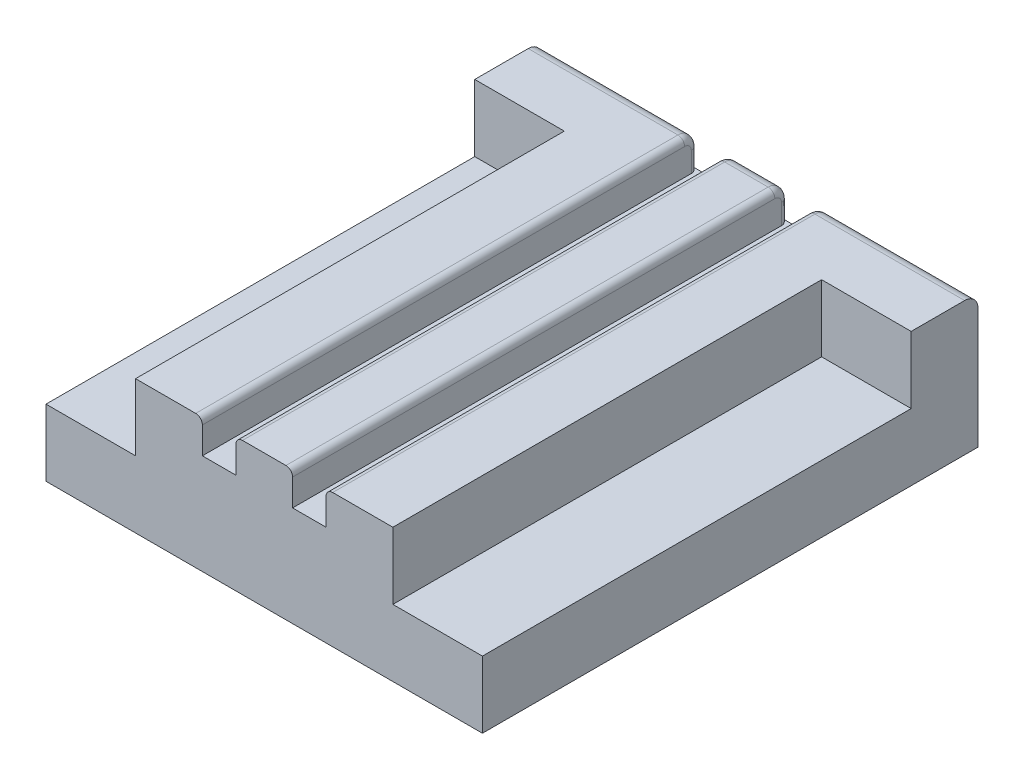
from build123d import *

# Parameters (mm, degrees)
SKETCH1_W                                  = 240
SKETCH1_H                                  = 200
BOSS_EXTRUDE1_DEPTH                        = 20
SKETCH7_W                                  = 120
SKETCH7_H                                  = 50
BOSS_EXTRUDE6_DEPTH                        = 20
FILLET1_R                                  = 2
SKETCH2_W                                  = 39.3
SKETCH2_H                                  = 125.7
CUT_EXTRUDE1_DEPTH                         = 10
CUT_EXTRUDE3_DEPTH                         = 5
MIRROR4_AT_THE_SECOND_PLANE_COPY_1_DEPTH   = 5
SKETCH11_W                                 = 104.748042719
SKETCH11_H                                 = 5
CUT_EXTRUDE4_DEPTH                         = 5
MIRROR6_AT_THE_SECOND_PLANE_COPY_1_SKETC_W = 104.748042719
MIRROR6_AT_THE_SECOND_PLANE_COPY_1_SKETC_H = 5
MIRROR6_AT_THE_SECOND_PLANE_COPY_1_DEPTH   = 5
SHELL1_START                               = 10
SHELL1_OUTLINE_W                           = 80.35
SHELL1_OUTLINE_H                           = 28.5
SHELL1_DEPTH                               = 10
FILLET3_R                                  = 1
SKETCH13_W                                 = 7.252545243
SKETCH13_H                                 = 2.335565418
SKETCH13_W_2                               = 1.720942939
SKETCH13_H_2                               = 2.581414408
CUT_EXTRUDE5_DEPTH                         = 2
CUT_EXTRUDE6_DEPTH                         = 10
MIRROR7_AT_THE_SECOND_PLANE_COPY_1_DEPTH   = 10
SKETCH15_W                                 = 101.789001661
SKETCH15_H                                 = 87.14110882
CUT_EXTRUDE7_DEPTH                         = 194.132079158
SKETCH16_W                                 = 242.295320333
SKETCH16_H                                 = 232.707041296
CUT_EXTRUDE8_DEPTH                         = 194.132079158


# Read off the part's stored shape, not the designer's step: Shell1
with BuildPart() as part:
    # Sketch1 → Boss-Extrude1 (new body)
    with BuildSketch(Plane(origin=(0, 0, 0), x_dir=(1, 0, 0), z_dir=(0, 1, 0))):
        Rectangle(SKETCH1_W, SKETCH1_H)
    extrude(amount=BOSS_EXTRUDE1_DEPTH)

    # Sketch7 → Boss-Extrude6 (add)
    with BuildSketch(Plane(origin=(0, 0, 0), x_dir=(1, 0, 0), z_dir=(0, 1, 0))):
        with Locations((0, 125)):
            Rectangle(SKETCH7_W, SKETCH7_H)
        with Locations((0, -125)):
            Rectangle(SKETCH7_W, SKETCH7_H)
    extrude(amount=BOSS_EXTRUDE6_DEPTH)

    # Fillet1
    fillet1_edges = [part.edges().sort_by_distance(p)[0] for p in [
        (-120, 20, 0),
        (90, 20, 100),
        (-90, 20, 100),
        (-60, 10, 150),
        (60, 10, 150),
        (-60, 20, 125),
        (0, 20, 150),
        (60, 20, 125),
        (-90, 20, -100),
        (60, 20, -125),
        (0, 20, -150),
        (60, 10, -150),
        (-60, 10, -150),
        (-60, 20, -125),
        (120, 20, 0),
        (120, 10, 100),
        (-120, 10, 100),
        (-120, 10, -100),
        (120, 10, -100),
        (90, 20, -100),
    ]]
    fillet(fillet1_edges, radius=FILLET1_R)

    # Sketch2 → Cut-Extrude1 (cut)
    with BuildSketch(Plane(origin=(0, 20, 0), x_dir=(1, 0, 0), z_dir=(0, 1, 0))):
        Rectangle(SKETCH2_W, SKETCH2_H)
    extrude(amount=-CUT_EXTRUDE1_DEPTH, mode=Mode.SUBTRACT)

    # Sketch10 → Cut-Extrude3 (cut)
    with BuildSketch(Plane(origin=(0, 20, 0), x_dir=(1, 0, 0), z_dir=(0, 1, 0))):
        Polygon((-9.25, -40.5), (-9.25, -33.162899401), (-4.25, -33.162899401), (-4.25, -40.5), (-4.25, -156.832928994), (-9.25, -156.832928994), align=None)
    cut_extrude3 = extrude(amount=-CUT_EXTRUDE3_DEPTH, mode=Mode.SUBTRACT)

    # Mirror4: Cut-Extrude3 across plane
    add(cut_extrude3.mirror(Plane(origin=(0, 0, 0), x_dir=(0, 0, 1), z_dir=(1, 0, 0))), mode=Mode.SUBTRACT)

    # Mirror4 at the second plane: Cut-Extrude3 across plane
    add(cut_extrude3.mirror(Plane.XY), mode=Mode.SUBTRACT)

    # Mirror4 at the second plane copy 1 sketc → Mirror4 at the second plane copy 1 (cut)
    with BuildSketch(Plane(origin=(0, 20, 0), x_dir=(-1, 0, 0), z_dir=(0, 1, 0))):
        Polygon((-9.25, -40.5), (-9.25, -33.162899401), (-4.25, -33.162899401), (-4.25, -40.5), (-4.25, -156.832928994), (-9.25, -156.832928994), align=None)
    extrude(amount=-MIRROR4_AT_THE_SECOND_PLANE_COPY_1_DEPTH, mode=Mode.SUBTRACT)

    # Sketch11 → Cut-Extrude4 (cut)
    with BuildSketch(Plane(origin=(0, 20, 0), x_dir=(1, 0, 0), z_dir=(0, 1, 0))):
        with Locations((-72.024021359, 26.75)):
            Rectangle(SKETCH11_W, SKETCH11_H)
        with Locations((-72.024021359, 40.35)):
            Rectangle(SKETCH11_W, SKETCH11_H)
    cut_extrude4 = extrude(amount=-CUT_EXTRUDE4_DEPTH, mode=Mode.SUBTRACT)

    # Mirror6: Cut-Extrude4 across plane
    add(cut_extrude4.mirror(Plane.XY), mode=Mode.SUBTRACT)

    # Mirror6 at the second plane: Cut-Extrude4 across plane
    add(cut_extrude4.mirror(Plane(origin=(0, 0, 0), x_dir=(0, 0, 1), z_dir=(1, 0, 0))), mode=Mode.SUBTRACT)

    # Mirror6 at the second plane copy 1 sketc → Mirror6 at the second plane copy 1 (cut)
    with BuildSketch(Plane(origin=(0, 20, 0), x_dir=(-1, 0, 0), z_dir=(0, 1, 0))):
        with Locations((-72.024021359, 26.75)):
            Rectangle(MIRROR6_AT_THE_SECOND_PLANE_COPY_1_SKETC_W, MIRROR6_AT_THE_SECOND_PLANE_COPY_1_SKETC_H)
        with Locations((-72.024021359, 40.35)):
            Rectangle(MIRROR6_AT_THE_SECOND_PLANE_COPY_1_SKETC_W, MIRROR6_AT_THE_SECOND_PLANE_COPY_1_SKETC_H)
    extrude(amount=-MIRROR6_AT_THE_SECOND_PLANE_COPY_1_DEPTH, mode=Mode.SUBTRACT)

    # Shell1 outline → Shell1 (cut)
    with BuildSketch(Plane(origin=(0, 0, 0), x_dir=(1, 0, 0), z_dir=(0, 1, 0)).offset(SHELL1_START)):
        Polygon((-29.65, 72.85), (-19.25, 72.85), (-19.25, 140), (-50, 140), (-50, 90), (-110, 90), (-110, 52.85), (-29.65, 52.85), align=None)
        Polygon((19.25, 72.85), (29.65, 72.85), (29.65, 52.85), (110, 52.85), (110, 90), (50, 90), (50, 140), (19.25, 140), align=None)
        Polygon((-110, -52.85), (-110, -90), (-50, -90), (-50, -140), (-19.25, -140), (-19.25, -72.85), (-29.65, -72.85), (-29.65, -52.85), align=None)
        with Locations((-69.825, 0)):
            Rectangle(SHELL1_OUTLINE_W, SHELL1_OUTLINE_H)
        Polygon((29.65, -72.85), (19.25, -72.85), (19.25, -140), (50, -140), (50, -90), (110, -90), (110, -52.85), (29.65, -52.85), align=None)
        with Locations((69.825, 0)):
            Rectangle(SHELL1_OUTLINE_W, SHELL1_OUTLINE_H)
    extrude(amount=SHELL1_DEPTH, mode=Mode.SUBTRACT)

    # Fillet3
    fillet3_edges = [part.edges().sort_by_distance(p)[0] for p in [
        (-4.25, 16.5, 150),
        (-4.25, 19.414213562, 149.414213562),
        (-9.25, 16.5, 150),
        (-9.25, 19.414213562, 149.414213562),
        (-4.25, 20, 105.425),
        (-9.25, 20, 105.425),
        (-9.25, 19.414213562, -149.414213562),
        (-9.25, 16.5, -150),
        (-9.25, 20, -105.425),
        (-4.25, 16.5, -150),
        (-4.25, 19.414213562, -149.414213562),
        (-4.25, 20, -105.425),
        (9.25, 16.5, 150),
        (9.25, 20, 105.425),
        (9.25, 19.414213562, 149.414213562),
        (4.25, 16.5, 150),
        (4.25, 19.414213562, 149.414213562),
        (4.25, 20, 105.425),
        (4.25, 16.5, -150),
        (4.25, 19.414213562, -149.414213562),
        (9.25, 19.414213562, -149.414213562),
        (9.25, 16.5, -150),
        (4.25, 20, -105.425),
        (9.25, 20, -105.425),
        (-120, 16.5, -24.25),
        (-120, 16.5, -29.25),
        (-119.414213562, 19.414213562, -24.25),
        (-119.414213562, 19.414213562, -29.25),
        (-68.825, 20, -24.25),
        (-68.825, 20, -29.25),
        (-120, 16.5, -37.85),
        (-120, 16.5, -42.85),
        (-68.825, 20, -37.85),
        (-68.825, 20, -42.85),
        (-119.414213562, 19.414213562, -37.85),
        (-119.414213562, 19.414213562, -42.85),
        (68.825, 20, -29.25),
        (119.414213562, 19.414213562, -29.25),
        (119.414213562, 19.414213562, -24.25),
        (68.825, 20, -24.25),
        (120, 16.5, -29.25),
        (120, 16.5, -24.25),
        (68.825, 20, -42.85),
        (119.414213562, 19.414213562, -42.85),
        (119.414213562, 19.414213562, -37.85),
        (68.825, 20, -37.85),
        (120, 16.5, -42.85),
        (120, 16.5, -37.85),
        (-120, 16.5, 29.25),
        (-120, 16.5, 24.25),
        (-68.825, 20, 29.25),
        (-119.414213562, 19.414213562, 29.25),
        (-119.414213562, 19.414213562, 24.25),
        (-68.825, 20, 24.25),
        (-120, 16.5, 42.85),
        (-120, 16.5, 37.85),
        (-68.825, 20, 42.85),
        (-119.414213562, 19.414213562, 42.85),
        (-119.414213562, 19.414213562, 37.85),
        (-68.825, 20, 37.85),
        (120, 16.5, 24.25),
        (120, 16.5, 29.25),
        (119.414213562, 19.414213562, 24.25),
        (119.414213562, 19.414213562, 29.25),
        (68.825, 20, 24.25),
        (68.825, 20, 29.25),
        (120, 16.5, 37.85),
        (120, 16.5, 42.85),
        (68.825, 20, 37.85),
        (68.825, 20, 42.85),
        (119.414213562, 19.414213562, 37.85),
        (119.414213562, 19.414213562, 42.85),
    ]]
    fillet(fillet3_edges, radius=FILLET3_R)

    # Sketch13 → Cut-Extrude5 (cut)
    # profile 1 of 12: a face of its own
    with BuildSketch(Plane(origin=(0, 10, 0), x_dir=(1, 0, 0), z_dir=(0, 1, 0))):
        Polygon((2.787359078, 56.729654742), (2.787359078, 55.37748529), (5, 55.37748529), (5, 53.041919872), (2.787359078, 53.041919872), (2.787359078, 48.247864542), (0.880108701, 48.247864542), (-4.711035156, 52.886343558), (-4.711035156, 55.37748529), (0.943491644, 55.37748529), (0.943491644, 56.729654742), align=None)
        Polygon((0.943491644, 53.041919872), (-2.596349692, 53.041919872), (0.943491644, 50.110938929), align=None, mode=Mode.SUBTRACT)
    # profile 2 of 12: a face of its own
    with BuildSketch(Plane(origin=(0, 10, 0), x_dir=(1, 0, 0), z_dir=(0, 1, 0))):
        with BuildLine():
            Line((5, 47.141544081), (5, 39.520225351))
            Line((5, 39.520225351), (3.409664338, 39.520225351))
            add(Edge.make_bspline(
                [(3.409664338, 39.520225351), (3.190599668, 39.81675512), (2.747057383, 40.417141716), (2.167094132, 41.14339637), (1.704390868, 41.703253096), (1.381972101, 42.083056551), (1.083256561, 42.417759603), (0.887687077, 42.622007507), (0.79559811, 42.718182933)],
                knots=[0, 0, 0, 0, 1.605452287, 3.25057426, 4.046675402, 4.768563423, 5.420146126, 6, 6, 6, 6], degree=3))
            add(Edge.make_bspline(
                [(0.79559811, 42.718182933), (0.732570292, 42.782561984), (0.609352585, 42.908421315), (0.423765416, 43.085974145), (0.244476812, 43.249198615), (0.074088064, 43.400664381), (-0.092796487, 43.534082219), (-0.252790737, 43.654099684), (-0.406497488, 43.759962438), (-0.599845109, 43.881290453), (-0.837875375, 44.00401532), (-1.125540586, 44.112139625), (-1.412736444, 44.178491494), (-1.604945873, 44.187117789), (-1.699385013, 44.191356186)],
                knots=[0, 0, 0, 0, 1.090093853, 2.131104457, 3.107135244, 4.023908394, 4.888948297, 5.691514549, 6.4435893, 7.146498757, 8.452673016, 9.675803408, 10.85804184, 12, 12, 12, 12], degree=3))
            add(Edge.make_bspline(
                [(-1.699385013, 44.191356186), (-1.754483363, 44.189605987), (-1.861179083, 44.186216799), (-2.017224671, 44.167846758), (-2.162681909, 44.132103765), (-2.300488192, 44.087839319), (-2.42643972, 44.024206924), (-2.544199113, 43.950411254), (-2.650531499, 43.859818439), (-2.749307162, 43.758726543), (-2.834556733, 43.642742478), (-2.911599654, 43.517157005), (-2.971430142, 43.377241787), (-3.024398474, 43.226819474), (-3.063653395, 43.063897589), (-3.092633036, 42.889340485), (-3.109905835, 42.703165878), (-3.111960528, 42.574807759), (-3.113016713, 42.508827152)],
                knots=[0, 0, 0, 0, 1.058578686, 2.049894692, 3.010224385, 3.931750511, 4.822578239, 5.71281177, 6.594427321, 7.498813824, 8.420995957, 9.353043897, 10.321837571, 11.3367408, 12.413304787, 13.535187771, 14.732999458, 16, 16, 16, 16], degree=3))
            add(Edge.make_bspline(
                [(-3.113016713, 42.508827152), (-3.110052719, 42.405568465), (-3.104041103, 42.196137688), (-3.053985994, 41.878413923), (-2.980602684, 41.552282773), (-2.873221808, 41.222921491), (-2.74714341, 40.895094854), (-2.596251992, 40.578640505), (-2.438170844, 40.269132893), (-2.314289691, 40.074405983), (-2.252545243, 39.977350819)],
                knots=[0, 0, 0, 0, 0.914703558, 1.855215137, 2.844920106, 3.875005138, 4.922433174, 5.955639304, 6.981056277, 8, 8, 8, 8], degree=3))
            Line((-2.252545243, 39.977350819), (-2.252545243, 39.766074342))
            Line((-2.252545243, 39.766074342), (-4.363389317, 39.766074342))
            add(Edge.make_bspline(
                [(-4.363389317, 39.766074342), (-4.396975153, 39.85152697), (-4.470639347, 40.038951181), (-4.568658946, 40.352153969), (-4.66491051, 40.720660415), (-4.763825821, 41.132864511), (-4.849735205, 41.573321973), (-4.910075419, 42.024211578), (-4.95119256, 42.474770211), (-4.954991729, 42.775713815), (-4.956884148, 42.92561802)],
                knots=[0, 0, 0, 0, 0.681686624, 1.495150967, 2.435076171, 3.509887788, 4.642826517, 5.765734475, 6.887081194, 8, 8, 8, 8], degree=3))
            add(Edge.make_bspline(
                [(-4.956884148, 42.92561802), (-4.954912362, 43.072306092), (-4.951074185, 43.357841566), (-4.914531776, 43.772464491), (-4.853049644, 44.160650299), (-4.769612134, 44.521836328), (-4.662431161, 44.856562797), (-4.529987596, 45.163893905), (-4.371768891, 45.443672956), (-4.191325, 45.69718541), (-3.986517109, 45.920499957), (-3.762299213, 46.116633841), (-3.516918106, 46.283180062), (-3.250583577, 46.417510178), (-2.964907945, 46.521931142), (-2.659732708, 46.596780352), (-2.333869778, 46.641015432), (-2.109911454, 46.646854566), (-1.995172081, 46.649846099)],
                knots=[0, 0, 0, 0, 1.302669921, 2.535710425, 3.693104205, 4.791067539, 5.825099944, 6.810730835, 7.758000335, 8.67487823, 9.568447078, 10.443087854, 11.315285082, 12.19521531, 13.085757283, 14.011200708, 14.981089066, 16, 16, 16, 16], degree=3))
            add(Edge.make_bspline(
                [(-1.995172081, 46.649846099), (-1.918295051, 46.648245135), (-1.764899121, 46.645050664), (-1.536586701, 46.623146341), (-1.311198259, 46.589276583), (-1.089189633, 46.538876948), (-0.870129482, 46.472993238), (-0.653296175, 46.39436831), (-0.439122967, 46.302496277), (-0.229338943, 46.193054838), (-0.018163961, 46.072147599), (0.191952814, 45.932794317), (0.405837655, 45.781094454), (0.620958688, 45.614342324), (0.835471411, 45.430057751), (1.055741697, 45.23549192), (1.273520634, 45.021368665), (1.417594688, 44.872241147), (1.490889788, 44.796375188)],
                knots=[0, 0, 0, 0, 0.907170522, 1.810115022, 2.704515666, 3.595334857, 4.494160497, 5.402400165, 6.316123003, 7.242010315, 8.19323076, 9.186549597, 10.215937183, 11.28746875, 12.397107329, 13.552885457, 14.755074217, 16, 16, 16, 16], degree=3))
            add(Edge.make_bspline(
                [(1.490889788, 44.796375188), (1.669671754, 44.600991906), (2.021428479, 44.216571794), (2.422503942, 43.720261203), (2.710127438, 43.347225494), (2.892573427, 43.11547907), (3.035611297, 42.923413887), (3.11966375, 42.809753418), (3.156132565, 42.760438229)],
                knots=[0, 0, 0, 0, 1.811045763, 3.563265038, 4.362127914, 5.033096026, 5.580478129, 6, 6, 6, 6], degree=3))
            Line((3.156132565, 42.760438229), (3.156132565, 47.141544081))
            Line((3.156132565, 47.141544081), (5, 47.141544081))
        make_face()
    # profile 3 of 12: a face of its own
    with BuildSketch(Plane(origin=(0, 10, 0), x_dir=(1, 0, 0), z_dir=(0, 1, 0))):
        with BuildLine():
            add(Edge.make_bspline(
                [(0.138720336, 37.553433421), (0.339837036, 37.551198694), (0.731017162, 37.546852061), (1.301575539, 37.503210957), (1.839727263, 37.435290008), (2.344336806, 37.340402007), (2.812295891, 37.218717557), (3.235819492, 37.059739443), (3.620265586, 36.877229499), (3.845547684, 36.720963882), (3.955141787, 36.64494457)],
                knots=[0, 0, 0, 0, 1.210994604, 2.355433537, 3.443919748, 4.476135166, 5.446013627, 6.351277171, 7.197937607, 8, 8, 8, 8], degree=3))
            add(Edge.make_bspline(
                [(3.955141787, 36.64494457), (4.057367971, 36.5617232), (4.260610648, 36.396265258), (4.524020765, 36.101981434), (4.745368417, 35.772676286), (4.897303004, 35.472877401), (4.999247268, 35.217133399), (5.063592063, 35.011802969), (5.122267484, 34.796985151), (5.167723638, 34.570405454), (5.201934481, 34.333084121), (5.226664862, 34.085073274), (5.242295446, 33.825562266), (5.244648027, 33.648682389), (5.245848991, 33.558387312)],
                knots=[0, 0, 0, 0, 1.363120718, 2.710110989, 4.070537742, 5.460816644, 6.180869889, 6.918733188, 7.687278466, 8.485437086, 9.309407483, 10.168795045, 11.065191617, 12, 12, 12, 12], degree=3))
            add(Edge.make_bspline(
                [(5.245848991, 33.558387312), (5.241905689, 33.384062955), (5.234297073, 33.047703496), (5.173081199, 32.562988904), (5.069699732, 32.118069919), (4.926806373, 31.711596248), (4.739854178, 31.34454147), (4.516760058, 31.013155063), (4.251279595, 30.717979546), (4.045332533, 30.554230832), (3.94169692, 30.471830054)],
                knots=[0, 0, 0, 0, 1.200851745, 2.317047666, 3.359233085, 4.342911255, 5.278031965, 6.189548012, 7.088953741, 8, 8, 8, 8], degree=3))
            add(Edge.make_bspline(
                [(3.94169692, 30.471830054), (3.829424185, 30.3947628), (3.600170882, 30.2373967), (3.214838014, 30.049115343), (2.792701976, 29.89168932), (2.331256748, 29.768085058), (1.834031119, 29.675388633), (1.301418942, 29.61187027), (0.734794995, 29.570336966), (0.344952566, 29.565716964), (0.144482422, 29.563341204)],
                knots=[0, 0, 0, 0, 0.822750793, 1.680001256, 2.58557045, 3.544707477, 4.565467581, 5.642347189, 6.787615291, 8, 8, 8, 8], degree=3))
            add(Edge.make_bspline(
                [(0.144482422, 29.563341204), (-0.061754837, 29.565532126), (-0.459970452, 29.569762495), (-1.036345286, 29.613069323), (-1.570746564, 29.680774054), (-2.065452333, 29.775711056), (-2.521358164, 29.900947264), (-2.938473361, 30.06222162), (-3.323134476, 30.249194002), (-3.55325365, 30.406272972), (-3.666176943, 30.483354226)],
                knots=[0, 0, 0, 0, 1.242237956, 2.39858964, 3.479780431, 4.485821505, 5.430991799, 6.32348679, 7.177307181, 8, 8, 8, 8], degree=3))
            add(Edge.make_bspline(
                [(-3.666176943, 30.483354226), (-3.769193286, 30.566416838), (-3.974708441, 30.732124775), (-4.238285133, 31.029639616), (-4.461065672, 31.362253167), (-4.645070962, 31.729678272), (-4.784115122, 32.135791847), (-4.885860052, 32.577168574), (-4.944671996, 33.056148657), (-4.952723667, 33.387282789), (-4.956884148, 33.558387312)],
                knots=[0, 0, 0, 0, 0.915406887, 1.826214983, 2.74012738, 3.682217607, 4.664024873, 5.706462388, 6.814877053, 8, 8, 8, 8], degree=3))
            add(Edge.make_bspline(
                [(-4.956884148, 33.558387312), (-4.955682618, 33.64868302), (-4.953320425, 33.826203271), (-4.937576888, 34.086978277), (-4.913381513, 34.337057391), (-4.877300412, 34.575699285), (-4.828262853, 34.80214551), (-4.773499009, 35.018778584), (-4.706561244, 35.224310597), (-4.601886899, 35.480626422), (-4.447267393, 35.781827029), (-4.217150947, 36.109134402), (-3.948246131, 36.405401156), (-3.739143401, 36.569659884), (-3.633525124, 36.652627351)],
                knots=[0, 0, 0, 0, 0.927772364, 1.823989051, 2.683453821, 3.508702832, 4.302191287, 5.063276402, 5.803871599, 6.520953588, 7.906777029, 9.27188215, 10.622021304, 12, 12, 12, 12], degree=3))
            add(Edge.make_bspline(
                [(-3.633525124, 36.652627351), (-3.521300204, 36.729189524), (-3.292789343, 36.885084383), (-2.908970475, 37.068290297), (-2.492360426, 37.225455121), (-2.036263275, 37.346342452), (-1.54437137, 37.439204828), (-1.015826808, 37.505677425), (-0.450933502, 37.546286922), (-0.061742996, 37.551003841), (0.138720336, 37.553433421)],
                knots=[0, 0, 0, 0, 0.826423845, 1.682753026, 2.582377666, 3.535958882, 4.552416628, 5.629628825, 6.779074777, 8, 8, 8, 8], degree=3))
        make_face()
        with BuildLine():
            add(Edge.make_bspline(
                [(0.138720336, 35.094943508), (-0.002794049, 35.093990238), (-0.275052116, 35.092156251), (-0.667644343, 35.074004214), (-1.028464631, 35.048543297), (-1.357952356, 35.010483072), (-1.656192237, 34.961169576), (-1.923473104, 34.900935006), (-2.158488294, 34.828227196), (-2.363936988, 34.745989678), (-2.54162794, 34.64913888), (-2.69467252, 34.537908006), (-2.823572221, 34.410664927), (-2.931286275, 34.270097317), (-3.011274034, 34.111739825), (-3.072443859, 33.941187009), (-3.106785969, 33.754382189), (-3.110895684, 33.625106618), (-3.113016713, 33.558387312)],
                knots=[0, 0, 0, 0, 1.684598718, 3.240982106, 4.677870026, 5.990101975, 7.188004416, 8.275163324, 9.249099904, 10.113910365, 10.905306099, 11.652292794, 12.358339015, 13.054983843, 13.750418457, 14.461547751, 15.206002611, 16, 16, 16, 16], degree=3))
            add(Edge.make_bspline(
                [(-3.113016713, 33.558387312), (-3.110895681, 33.491668012), (-3.106785962, 33.362392453), (-3.072443884, 33.175587552), (-3.011273943, 33.005035023), (-2.931286606, 32.84667649), (-2.823570979, 32.706112772), (-2.694677343, 32.578854684), (-2.541608299, 32.467684345), (-2.363496496, 32.37029911), (-2.157013742, 32.289020864), (-1.921590867, 32.215742751), (-1.654258135, 32.155647372), (-1.355414385, 32.106122047), (-1.024612933, 32.068276855), (-0.661244964, 32.04269777), (-0.266085327, 32.024665897), (0.008090715, 32.022799039), (0.150244508, 32.021831116)],
                knots=[0, 0, 0, 0, 0.791766581, 1.534129826, 2.243261137, 2.936741863, 3.631429404, 4.335491923, 5.08037989, 5.869552125, 6.738971147, 7.710171362, 8.794275798, 9.988812621, 11.304907075, 12.745337551, 14.312534512, 16, 16, 16, 16], degree=3))
            add(Edge.make_bspline(
                [(0.150244508, 32.021831116), (0.289201434, 32.022765136), (0.556986265, 32.024565091), (0.943773412, 32.043063349), (1.30096878, 32.067483158), (1.627502144, 32.109075315), (1.924420257, 32.156514098), (2.190195476, 32.220950105), (2.427221865, 32.292197549), (2.635687527, 32.376524358), (2.816464841, 32.475577579), (2.974492505, 32.586386469), (3.106149375, 32.714997304), (3.215613674, 32.855867424), (3.298888327, 33.012083539), (3.358752163, 33.181622444), (3.396338685, 33.365314373), (3.400067537, 33.492898418), (3.401981557, 33.558387312)],
                knots=[0, 0, 0, 0, 1.658832269, 3.196746878, 4.622488866, 5.931787449, 7.125569234, 8.210133994, 9.194149195, 10.078471196, 10.889203548, 11.650697572, 12.375032472, 13.07829054, 13.77251817, 14.478471121, 15.218999177, 16, 16, 16, 16], degree=3))
            add(Edge.make_bspline(
                [(3.401981557, 33.558387312), (3.400068186, 33.623876875), (3.3963406, 33.751462223), (3.358745104, 33.935144911), (3.298913291, 34.10471679), (3.215521541, 34.260812329), (3.106775331, 34.40178813), (2.97377315, 34.528364287), (2.816557237, 34.639341559), (2.635707586, 34.738476019), (2.42683161, 34.821967534), (2.190341985, 34.897522561), (1.921851262, 34.956560743), (1.624132619, 35.009519497), (1.295502071, 35.045529443), (0.936895825, 35.074962985), (0.547988509, 35.091838226), (0.278306115, 35.093884415), (0.138720336, 35.094943508)],
                knots=[0, 0, 0, 0, 0.778971247, 1.517574904, 2.221693305, 2.914116855, 3.615547377, 4.332711038, 5.092226179, 5.900851692, 6.782875619, 7.766611013, 8.854037796, 10.053520173, 11.366075456, 12.788704916, 14.337855446, 16, 16, 16, 16], degree=3))
        make_face(mode=Mode.SUBTRACT)
    # profile 4 of 12: a face of its own
    with BuildSketch(Plane(origin=(0, 10, 0), x_dir=(1, 0, 0), z_dir=(0, 1, 0))):
        with BuildLine():
            Line((5, 28.211171751), (5, 20.589853021))
            Line((5, 20.589853021), (3.409664338, 20.589853021))
            add(Edge.make_bspline(
                [(3.409664338, 20.589853021), (3.190599668, 20.88638279), (2.747057383, 21.486769386), (2.167094132, 22.21302404), (1.704390868, 22.772880767), (1.381972101, 23.152684221), (1.083256561, 23.487387273), (0.887687077, 23.691635177), (0.79559811, 23.787810603)],
                knots=[0, 0, 0, 0, 1.605452287, 3.25057426, 4.046675402, 4.768563423, 5.420146126, 6, 6, 6, 6], degree=3))
            add(Edge.make_bspline(
                [(0.79559811, 23.787810603), (0.732570292, 23.852189654), (0.609352585, 23.978048985), (0.423765416, 24.155601815), (0.244476812, 24.318826285), (0.074088064, 24.470292051), (-0.092796487, 24.60370989), (-0.252790737, 24.723727355), (-0.406497488, 24.829590108), (-0.599845109, 24.950918123), (-0.837875375, 25.07364299), (-1.125540586, 25.181767295), (-1.412736444, 25.248119164), (-1.604945873, 25.256745459), (-1.699385013, 25.260983856)],
                knots=[0, 0, 0, 0, 1.090093853, 2.131104457, 3.107135244, 4.023908394, 4.888948297, 5.691514549, 6.4435893, 7.146498757, 8.452673016, 9.675803408, 10.85804184, 12, 12, 12, 12], degree=3))
            add(Edge.make_bspline(
                [(-1.699385013, 25.260983856), (-1.754483363, 25.259233658), (-1.861179083, 25.25584447), (-2.017224671, 25.237474428), (-2.162681909, 25.201731435), (-2.300488192, 25.157466989), (-2.42643972, 25.093834595), (-2.544199113, 25.020038924), (-2.650531499, 24.929446109), (-2.749307162, 24.828354213), (-2.834556733, 24.712370148), (-2.911599654, 24.586784675), (-2.971430142, 24.446869457), (-3.024398474, 24.296447144), (-3.063653395, 24.133525259), (-3.092633036, 23.958968155), (-3.109905835, 23.772793548), (-3.111960528, 23.644435429), (-3.113016713, 23.578454822)],
                knots=[0, 0, 0, 0, 1.058578686, 2.049894692, 3.010224385, 3.931750511, 4.822578239, 5.71281177, 6.594427321, 7.498813824, 8.420995957, 9.353043897, 10.321837571, 11.3367408, 12.413304787, 13.535187771, 14.732999458, 16, 16, 16, 16], degree=3))
            add(Edge.make_bspline(
                [(-3.113016713, 23.578454822), (-3.110052719, 23.475196136), (-3.104041103, 23.265765358), (-3.053985994, 22.948041593), (-2.980602684, 22.621910443), (-2.873221808, 22.292549161), (-2.74714341, 21.964722525), (-2.596251992, 21.648268175), (-2.438170844, 21.338760563), (-2.314289691, 21.144033653), (-2.252545243, 21.046978489)],
                knots=[0, 0, 0, 0, 0.914703558, 1.855215137, 2.844920106, 3.875005138, 4.922433174, 5.955639304, 6.981056277, 8, 8, 8, 8], degree=3))
            Line((-2.252545243, 21.046978489), (-2.252545243, 20.835702012))
            Line((-2.252545243, 20.835702012), (-4.363389317, 20.835702012))
            add(Edge.make_bspline(
                [(-4.363389317, 20.835702012), (-4.396975153, 20.92115464), (-4.470639347, 21.108578851), (-4.568658946, 21.421781639), (-4.66491051, 21.790288086), (-4.763825821, 22.202492181), (-4.849735205, 22.642949643), (-4.910075419, 23.093839248), (-4.95119256, 23.544397881), (-4.954991729, 23.845341485), (-4.956884148, 23.99524569)],
                knots=[0, 0, 0, 0, 0.681686624, 1.495150967, 2.435076171, 3.509887788, 4.642826517, 5.765734475, 6.887081194, 8, 8, 8, 8], degree=3))
            add(Edge.make_bspline(
                [(-4.956884148, 23.99524569), (-4.954912362, 24.141933762), (-4.951074185, 24.427469237), (-4.914531776, 24.842092162), (-4.853049644, 25.230277969), (-4.769612134, 25.591463998), (-4.662431161, 25.926190468), (-4.529987596, 26.233521576), (-4.371768891, 26.513300626), (-4.191325, 26.76681308), (-3.986517109, 26.990127627), (-3.762299213, 27.186261512), (-3.516918106, 27.352807733), (-3.250583577, 27.487137848), (-2.964907945, 27.591558812), (-2.659732708, 27.666408023), (-2.333869778, 27.710643103), (-2.109911454, 27.716482236), (-1.995172081, 27.719473769)],
                knots=[0, 0, 0, 0, 1.302669921, 2.535710425, 3.693104205, 4.791067539, 5.825099944, 6.810730835, 7.758000335, 8.67487823, 9.568447078, 10.443087854, 11.315285082, 12.19521531, 13.085757283, 14.011200708, 14.981089066, 16, 16, 16, 16], degree=3))
            add(Edge.make_bspline(
                [(-1.995172081, 27.719473769), (-1.918295051, 27.717872805), (-1.764899121, 27.714678334), (-1.536586701, 27.692774011), (-1.311198259, 27.658904253), (-1.089189633, 27.608504619), (-0.870129482, 27.542620908), (-0.653296175, 27.46399598), (-0.439122967, 27.372123947), (-0.229338943, 27.262682508), (-0.018163961, 27.141775269), (0.191952814, 27.002421987), (0.405837655, 26.850722124), (0.620958688, 26.683969994), (0.835471411, 26.499685422), (1.055741697, 26.30511959), (1.273520634, 26.090996335), (1.417594688, 25.941868817), (1.490889788, 25.866002858)],
                knots=[0, 0, 0, 0, 0.907170522, 1.810115022, 2.704515666, 3.595334857, 4.494160497, 5.402400165, 6.316123003, 7.242010315, 8.19323076, 9.186549597, 10.215937183, 11.28746875, 12.397107329, 13.552885457, 14.755074217, 16, 16, 16, 16], degree=3))
            add(Edge.make_bspline(
                [(1.490889788, 25.866002858), (1.669671754, 25.670619576), (2.021428479, 25.286199464), (2.422503942, 24.789888873), (2.710127438, 24.416853164), (2.892573427, 24.18510674), (3.035611297, 23.993041557), (3.11966375, 23.879381088), (3.156132565, 23.830065899)],
                knots=[0, 0, 0, 0, 1.811045763, 3.563265038, 4.362127914, 5.033096026, 5.580478129, 6, 6, 6, 6], degree=3))
            Line((3.156132565, 23.830065899), (3.156132565, 28.211171751))
            Line((3.156132565, 28.211171751), (5, 28.211171751))
        make_face()
    # profile 5 of 12: a face of its own
    with BuildSketch(Plane(origin=(0, 10, 0), x_dir=(1, 0, 0), z_dir=(0, 1, 0))):
        Polygon((5, 13.583156769), (5, 11.124666856), (-1.524601746, 11.124666856), (2.664434583, 9.338420279), (2.664434583, 7.625160121), (-1.524601746, 5.838913543), (5, 5.838913543), (5, 3.503348126), (-4.711035156, 3.503348126), (-4.711035156, 6.382470298), (0.125275469, 8.549014533), (-4.711035156, 10.709796683), (-4.711035156, 13.583156769), align=None)
    # profile 6 of 12: a face of its own
    with BuildSketch(Plane(origin=(0, 10, 0), x_dir=(1, 0, 0), z_dir=(0, 1, 0))):
        Polygon((5, 1.4136317), (5, -5.593064552), (-4.711035156, -5.593064552), (-4.711035156, 1.4136317), (-2.867167722, 1.4136317), (-2.867167722, -3.134574639), (-1.146224782, -3.134574639), (-1.146224782, 1.044858213), (0.697642652, 1.044858213), (0.697642652, -3.134574639), (3.156132565, -3.134574639), (3.156132565, 1.4136317), align=None)
    # profile 7 of 12: a face of its own
    with BuildSketch(Plane(origin=(0, 10, 0), x_dir=(1, 0, 0), z_dir=(0, 1, 0))):
        with BuildLine():
            add(Edge.make_bspline(
                [(4.475650198, -7.805705474), (4.519354839, -7.923859504), (4.612512661, -8.17570855), (4.743574124, -8.583890089), (4.866671289, -9.047274178), (4.996208031, -9.552124696), (5.106381276, -10.084227717), (5.187397941, -10.625264318), (5.237323662, -11.165972628), (5.243010567, -11.526628491), (5.245848991, -11.706637515)],
                knots=[0, 0, 0, 0, 0.756485239, 1.612472169, 2.573171414, 3.635272123, 4.742182008, 5.834553763, 6.919191659, 8, 8, 8, 8], degree=3))
            add(Edge.make_bspline(
                [(5.245848991, -11.706637515), (5.241962961, -11.909112321), (5.234392087, -12.303579456), (5.17063924, -12.878829296), (5.062937634, -13.419584917), (4.916847086, -13.928231287), (4.72267015, -14.400885619), (4.491042888, -14.842463027), (4.211679163, -15.247896521), (3.893490591, -15.618759753), (3.53655883, -15.9505899), (3.145758166, -16.239699566), (2.72146993, -16.48347792), (2.264846611, -16.681095463), (1.776896349, -16.838089964), (1.255150105, -16.944841813), (0.702111097, -17.014888699), (0.322052776, -17.021601157), (0.127196165, -17.025042647)],
                knots=[0, 0, 0, 0, 1.160705024, 2.261318311, 3.313123859, 4.319096107, 5.290496718, 6.238021168, 7.172737693, 8.107230733, 9.03451477, 9.961071912, 10.888559376, 11.833805606, 12.808979065, 13.821966168, 14.883317984, 16, 16, 16, 16], degree=3))
            add(Edge.make_bspline(
                [(0.127196165, -17.025042647), (-0.058682323, -17.02067815), (-0.422730133, -17.012130168), (-0.955049114, -16.943336637), (-1.460067022, -16.832867692), (-1.937766829, -16.677677821), (-2.386372436, -16.473696921), (-2.808700267, -16.227656485), (-3.203463564, -15.935836699), (-3.565000576, -15.598836264), (-3.895700628, -15.226075236), (-4.177610929, -14.810267907), (-4.422741814, -14.363406013), (-4.616779655, -13.8775432), (-4.772219277, -13.359136807), (-4.876169413, -12.804694831), (-4.946971316, -12.216810998), (-4.953520434, -11.812500101), (-4.956884148, -11.604840667)],
                knots=[0, 0, 0, 0, 1.061573339, 2.079118747, 3.060574866, 4.011305467, 4.942696719, 5.870461571, 6.798745348, 7.740825567, 8.68941507, 9.638984161, 10.604583371, 11.595514188, 12.621960228, 13.691449096, 14.814297672, 16, 16, 16, 16], degree=3))
            add(Edge.make_bspline(
                [(-4.956884148, -11.604840667), (-4.954318925, -11.445386322), (-4.949235323, -11.129389392), (-4.919388643, -10.661251886), (-4.863951384, -10.205248288), (-4.792453594, -9.753475749), (-4.684946461, -9.294730481), (-4.534849919, -8.818874824), (-4.346707534, -8.316660693), (-4.193287983, -7.980233106), (-4.113698935, -7.805705474)],
                knots=[0, 0, 0, 0, 0.974479143, 1.931163549, 2.86485946, 3.780778834, 4.725046501, 5.741022375, 6.828116267, 8, 8, 8, 8], degree=3))
            Line((-4.113698935, -7.805705474), (-1.883771756, -7.805705474))
            Line((-1.883771756, -7.805705474), (-1.883771756, -8.091889065))
            add(Edge.make_bspline(
                [(-1.883771756, -8.091889065), (-1.906716104, -8.126531064), (-1.957410079, -8.203070203), (-2.043059993, -8.326945943), (-2.137489474, -8.476111594), (-2.284548962, -8.694884397), (-2.45960062, -8.978067997), (-2.581693909, -9.213466955), (-2.640525683, -9.326896107)],
                knots=[0, 0, 0, 0, 0.515980687, 1.140024195, 1.869947604, 2.707876564, 4.413660046, 6, 6, 6, 6], degree=3))
            add(Edge.make_bspline(
                [(-2.640525683, -9.326896107), (-2.672756546, -9.393740863), (-2.73882048, -9.530753251), (-2.823836627, -9.749019276), (-2.905177649, -9.981830174), (-2.978097, -10.22950925), (-3.037034138, -10.489919732), (-3.082413494, -10.759686706), (-3.106467195, -11.03779789), (-3.110821171, -11.225783758), (-3.113016713, -11.320577771)],
                knots=[0, 0, 0, 0, 0.861448091, 1.765719082, 2.717953576, 3.724891765, 4.761927522, 5.816719679, 6.89905606, 8, 8, 8, 8], degree=3))
            add(Edge.make_bspline(
                [(-3.113016713, -11.320577771), (-3.110164997, -11.430782772), (-3.104578279, -11.646682304), (-3.068710383, -11.963218824), (-3.004292393, -12.263584213), (-2.918860854, -12.549882667), (-2.805175217, -12.820581595), (-2.662381265, -13.075068024), (-2.499039638, -13.320076357), (-2.36711736, -13.466852812), (-2.300562624, -13.540901474)],
                knots=[0, 0, 0, 0, 1.091217493, 2.137773647, 3.148547478, 4.129133693, 5.092188092, 6.048375109, 7.015406034, 8, 8, 8, 8], degree=3))
            add(Edge.make_bspline(
                [(-2.300562624, -13.540901474), (-2.231129169, -13.608753509), (-2.090799964, -13.745886571), (-1.846186727, -13.91943259), (-1.579009792, -14.07619004), (-1.283734201, -14.208811415), (-0.962723927, -14.314570988), (-0.616833633, -14.387928819), (-0.248028071, -14.435679856), (0.006035391, -14.440927383), (0.136799641, -14.443628239)],
                knots=[0, 0, 0, 0, 0.871242595, 1.760833901, 2.686460846, 3.652134751, 4.663748384, 5.717797841, 6.825370436, 8, 8, 8, 8], degree=3))
            add(Edge.make_bspline(
                [(0.136799641, -14.443628239), (0.270078203, -14.441217619), (0.528956778, -14.436535262), (0.904701948, -14.395518364), (1.257245759, -14.329288021), (1.585144219, -14.233472949), (1.889752999, -14.11198958), (2.170660406, -13.964565335), (2.424839249, -13.78559248), (2.657673098, -13.584235453), (2.862193118, -13.352834409), (3.041867765, -13.096983341), (3.191530728, -12.813783401), (3.315763592, -12.506455713), (3.407777269, -12.172177215), (3.477785429, -11.813452581), (3.51753353, -11.428392977), (3.522401475, -11.163169785), (3.524906052, -11.026711399)],
                knots=[0, 0, 0, 0, 1.162877018, 2.258757441, 3.29433279, 4.289818334, 5.235063129, 6.152415668, 7.05144509, 7.94239879, 8.832861761, 9.739671241, 10.664582224, 11.622279774, 12.626959197, 13.685538709, 14.809200461, 16, 16, 16, 16], degree=3))
            add(Edge.make_bspline(
                [(3.524906052, -11.026711399), (3.524545414, -10.976125561), (3.523787414, -10.869802624), (3.51698298, -10.707868976), (3.511542352, -10.544994826), (3.50110347, -10.438303115), (3.496095624, -10.387119882)],
                knots=[0, 0, 0, 0, 0.947728294, 1.991965744, 3.036685378, 4, 4, 4, 4], degree=3))
            Line((3.496095624, -10.387119882), (1.435189626, -10.387119882))
            Line((1.435189626, -10.387119882), (1.435189626, -12.353911813))
            Line((1.435189626, -12.353911813), (-0.408677809, -12.353911813))
            Line((-0.408677809, -12.353911813), (-0.408677809, -7.805705474))
            Line((-0.408677809, -7.805705474), (4.475650198, -7.805705474))
        make_face()
    # profile 8 of 12: a face of its own
    with BuildSketch(Plane(origin=(0, 10, 0), x_dir=(1, 0, 0), z_dir=(0, 1, 0))):
        with Locations((1.373727378, -19.913768295)):
            Rectangle(SKETCH13_W, SKETCH13_H)
    # profile 9 of 12: a face of its own
    with BuildSketch(Plane(origin=(0, 10, 0), x_dir=(1, 0, 0), z_dir=(0, 1, 0))):
        with Locations((-4.219337174, -19.913768295)):
            Rectangle(SKETCH13_W_2, SKETCH13_H_2)
    # profile 10 of 12: a face of its own
    with BuildSketch(Plane(origin=(0, 10, 0), x_dir=(1, 0, 0), z_dir=(0, 1, 0))):
        with BuildLine():
            add(Edge.make_bspline(
                [(5.245848991, -30.773379208), (5.241556228, -30.949600555), (5.233101922, -31.296656552), (5.17328717, -31.807137753), (5.071443943, -32.296870987), (4.929457053, -32.76358831), (4.750483589, -33.205121013), (4.527408056, -33.614715808), (4.267338932, -33.994815031), (4.061606502, -34.220067298), (3.958983177, -34.332427496)],
                knots=[0, 0, 0, 0, 1.089850102, 2.146385891, 3.173869964, 4.179760968, 5.160008291, 6.115072822, 7.059761785, 8, 8, 8, 8], degree=3))
            add(Edge.make_bspline(
                [(3.958983177, -34.332427496), (3.848038568, -34.438295465), (3.624492228, -34.651612698), (3.240912088, -34.92404395), (2.819806379, -35.161121156), (2.440058042, -35.326067869), (2.118408243, -35.437370727), (1.865302565, -35.510926057), (1.602961267, -35.571890876), (1.331038558, -35.621175666), (1.050675199, -35.662875321), (0.76008365, -35.687900337), (0.460358885, -35.70657835), (0.257194686, -35.708560179), (0.154085898, -35.709565986)],
                knots=[0, 0, 0, 0, 1.326589366, 2.672993315, 4.060770367, 5.505883836, 6.25107509, 7.007321983, 7.7873399, 8.582269437, 9.400071632, 10.240855478, 11.107208546, 12, 12, 12, 12], degree=3))
            add(Edge.make_bspline(
                [(0.154085898, -35.709565986), (-0.036260272, -35.705853317), (-0.409159179, -35.698579988), (-0.954067146, -35.631518817), (-1.472101576, -35.524248732), (-1.962272567, -35.375865598), (-2.421254864, -35.182794221), (-2.847342954, -34.951680217), (-3.242424741, -34.683652344), (-3.47520079, -34.471076121), (-3.591269829, -34.365079315)],
                knots=[0, 0, 0, 0, 1.119324668, 2.1928203, 3.223958197, 4.228260008, 5.200520162, 6.147632129, 7.076354466, 8, 8, 8, 8], degree=3))
            add(Edge.make_bspline(
                [(-3.591269829, -34.365079315), (-3.696426816, -34.256022231), (-3.907914238, -34.036691095), (-4.17855444, -33.660997219), (-4.413868173, -33.249571895), (-4.610724175, -32.802820982), (-4.765892728, -32.325941651), (-4.877010675, -31.82562766), (-4.943259501, -31.303347455), (-4.952287649, -30.948354573), (-4.956884148, -30.767617122)],
                knots=[0, 0, 0, 0, 0.919195442, 1.8486482, 2.803167129, 3.793795735, 4.808307604, 5.844199062, 6.902417522, 8, 8, 8, 8], degree=3))
            add(Edge.make_bspline(
                [(-4.956884148, -30.767617122), (-4.956393428, -30.668359933), (-4.955436829, -30.474869682), (-4.94084827, -30.191814102), (-4.921289403, -29.923828157), (-4.879474294, -29.592200908), (-4.814808823, -29.204474119), (-4.7421777, -28.904822537), (-4.707193766, -28.760490591)],
                knots=[0, 0, 0, 0, 0.880714095, 1.716848845, 2.514717796, 3.264532192, 4.682418473, 6, 6, 6, 6], degree=3))
            add(Edge.make_bspline(
                [(-4.707193766, -28.760490591), (-4.664108705, -28.621612355), (-4.581310973, -28.354726269), (-4.434982607, -27.98111963), (-4.28414942, -27.652264541), (-4.186257609, -27.446632632), (-4.140588669, -27.350700282)],
                knots=[0, 0, 0, 0, 1.146660616, 2.203568899, 3.161920647, 4, 4, 4, 4], degree=3))
            Line((-4.140588669, -27.350700282), (-1.760847261, -27.350700282))
            Line((-1.760847261, -27.350700282), (-1.760847261, -27.636883873))
            add(Edge.make_bspline(
                [(-1.760847261, -27.636883873), (-1.789760882, -27.669445598), (-1.850028949, -27.737317837), (-1.943169449, -27.84646079), (-2.044289807, -27.966859077), (-2.193791638, -28.146156267), (-2.382825876, -28.396964235), (-2.52216278, -28.612309765), (-2.594428997, -28.723997382)],
                knots=[0, 0, 0, 0, 0.571444814, 1.191129738, 1.882836886, 2.634784766, 4.254652092, 6, 6, 6, 6], degree=3))
            add(Edge.make_bspline(
                [(-2.594428997, -28.723997382), (-2.664236929, -28.846886536), (-2.805685787, -29.09589163), (-2.943550161, -29.429418426), (-3.032587435, -29.709146116), (-3.077362003, -29.929392289), (-3.107853006, -30.156624515), (-3.111280534, -30.311028434), (-3.113016713, -30.389240159)],
                knots=[0, 0, 0, 0, 1.439173741, 2.916136845, 3.667290802, 4.427345131, 5.203387771, 6, 6, 6, 6], degree=3))
            add(Edge.make_bspline(
                [(-3.113016713, -30.389240159), (-3.110477824, -30.475745648), (-3.105440763, -30.647369353), (-3.07497042, -30.902187581), (-3.020147889, -31.150575186), (-2.946619655, -31.393340851), (-2.845477271, -31.627774464), (-2.718252775, -31.853674636), (-2.562057311, -32.070037457), (-2.439651919, -32.20231689), (-2.377390434, -32.269600803)],
                knots=[0, 0, 0, 0, 1.001598119, 1.9871338, 2.96553644, 3.943152672, 4.919306753, 5.914963555, 6.939446524, 8, 8, 8, 8], degree=3))
            add(Edge.make_bspline(
                [(-2.377390434, -32.269600803), (-2.309583745, -32.332034441), (-2.171025631, -32.45961311), (-1.93152049, -32.625206542), (-1.660665123, -32.770051169), (-1.360441958, -32.900067806), (-1.026703819, -33.004078191), (-0.659549693, -33.075068855), (-0.259970233, -33.119887624), (0.017588233, -33.125326369), (0.161768679, -33.128151577)],
                knots=[0, 0, 0, 0, 0.80388915, 1.642689914, 2.53299325, 3.481872775, 4.4947599, 5.577680681, 6.741702658, 8, 8, 8, 8], degree=3))
            add(Edge.make_bspline(
                [(0.161768679, -33.128151577), (0.311768837, -33.125923628), (0.599876693, -33.121644368), (1.011428999, -33.069407329), (1.386636838, -32.994288328), (1.721395513, -32.879071876), (2.020823568, -32.741957475), (2.287301408, -32.588864868), (2.521133588, -32.418332338), (2.653723475, -32.287257692), (2.71821405, -32.223504117)],
                knots=[0, 0, 0, 0, 1.290334302, 2.478367041, 3.565730986, 4.578276722, 5.517838544, 6.396912514, 7.220272109, 8, 8, 8, 8], degree=3))
            add(Edge.make_bspline(
                [(2.71821405, -32.223504117), (2.776624204, -32.15678903), (2.892154246, -32.024832576), (3.038823686, -31.808811236), (3.156499876, -31.579934787), (3.248205125, -31.341825956), (3.315689405, -31.098752861), (3.366730598, -30.856410279), (3.396189151, -30.615336617), (3.400060024, -30.45525906), (3.401981557, -30.375795292)],
                knots=[0, 0, 0, 0, 1.054325691, 2.085361559, 3.097224921, 4.110091334, 5.115626892, 6.095649915, 7.054665517, 8, 8, 8, 8], degree=3))
            add(Edge.make_bspline(
                [(3.401981557, -30.375795292), (3.399995416, -30.300167635), (3.396010997, -30.148450175), (3.367969377, -29.92183692), (3.324531763, -29.696128902), (3.260202951, -29.473850088), (3.18176618, -29.256712893), (3.091757836, -29.045457401), (2.985752349, -28.843934907), (2.905928292, -28.715220777), (2.866107583, -28.651010962)],
                knots=[0, 0, 0, 0, 0.991289386, 1.988636345, 2.989438367, 4.001683697, 5.01851186, 6.01479875, 7.009670459, 8, 8, 8, 8], degree=3))
            add(Edge.make_bspline(
                [(2.866107583, -28.651010962), (2.799086235, -28.54754028), (2.667016335, -28.343644611), (2.482727048, -28.10690862), (2.33514417, -27.932313621), (2.23417018, -27.813138173), (2.139586208, -27.707238781), (2.078704196, -27.641290482), (2.049812104, -27.60999414)],
                knots=[0, 0, 0, 0, 1.674278229, 3.299273488, 4.071081905, 4.780574956, 5.421311183, 6, 6, 6, 6], degree=3))
            Line((2.049812104, -27.60999414), (2.049812104, -27.350700282))
            Line((2.049812104, -27.350700282), (4.400743084, -27.350700282))
            add(Edge.make_bspline(
                [(4.400743084, -27.350700282), (4.453977989, -27.469107265), (4.557995254, -27.700466195), (4.710217804, -28.043257711), (4.853488894, -28.385337096), (4.925202683, -28.621478965), (4.961586095, -28.741283639)],
                knots=[0, 0, 0, 0, 1.037949104, 2.028079651, 2.999562103, 4, 4, 4, 4], degree=3))
            add(Edge.make_bspline(
                [(4.961586095, -28.741283639), (5.004421769, -28.893824294), (5.086847599, -29.1873481), (5.164067273, -29.560966602), (5.209771736, -29.869797121), (5.23105018, -30.136648007), (5.244470102, -30.442236078), (5.245371714, -30.658760047), (5.245848991, -30.773379208)],
                knots=[0, 0, 0, 0, 1.383532347, 2.662238992, 3.328886368, 4.109040656, 4.999001483, 6, 6, 6, 6], degree=3))
        make_face()
    # profile 11 of 12: a face of its own
    with BuildSketch(Plane(origin=(0, 10, 0), x_dir=(1, 0, 0), z_dir=(0, 1, 0))):
        with BuildLine():
            add(Edge.make_bspline(
                [(2.021001676, -36.938810942), (2.135834195, -36.941779245), (2.360423317, -36.947584644), (2.687160369, -37.003329886), (2.994969738, -37.09114997), (3.282415269, -37.214700456), (3.547482787, -37.370068437), (3.793917062, -37.547462735), (4.012640519, -37.757602713), (4.139226852, -37.914392754), (4.202911474, -37.993272632)],
                knots=[0, 0, 0, 0, 1.09475917, 2.141126953, 3.152168046, 4.142704369, 5.117043167, 6.078545687, 7.033330935, 8, 8, 8, 8], degree=3))
            add(Edge.make_bspline(
                [(4.202911474, -37.993272632), (4.271430436, -38.089328613), (4.40755836, -38.280164856), (4.576639788, -38.587433573), (4.713481332, -38.908937379), (4.823111743, -39.248810358), (4.903771308, -39.619354907), (4.959791089, -40.029680334), (4.994197282, -40.485748637), (4.998006227, -40.805105318), (5, -40.972270956)],
                knots=[0, 0, 0, 0, 0.900219365, 1.788482918, 2.670971805, 3.564424711, 4.510769046, 5.562163026, 6.723926581, 8, 8, 8, 8], degree=3))
            Line((5, -40.972270956), (5, -45.174752151))
            Line((5, -45.174752151), (-4.711035156, -45.174752151))
            Line((-4.711035156, -45.174752151), (-4.711035156, -41.425555034))
            add(Edge.make_bspline(
                [(-4.711035156, -41.425555034), (-4.710541486, -41.331439942), (-4.70958769, -41.149604829), (-4.705841049, -40.887095211), (-4.699877008, -40.643807445), (-4.693192491, -40.420271668), (-4.681063463, -40.216067051), (-4.668157953, -40.032247924), (-4.652477333, -39.867707729), (-4.630893633, -39.673277593), (-4.585539799, -39.443346024), (-4.510417909, -39.173669198), (-4.412392074, -38.905016505), (-4.330200075, -38.730862363), (-4.288482202, -38.642467624)],
                knots=[0, 0, 0, 0, 1.191100834, 2.301266995, 3.32247628, 4.271027234, 5.131271201, 5.911180066, 6.602939548, 7.223035301, 8.386250696, 9.563798057, 10.763466492, 12, 12, 12, 12], degree=3))
            add(Edge.make_bspline(
                [(-4.288482202, -38.642467624), (-4.24037863, -38.555082717), (-4.14649073, -38.384526039), (-3.96681891, -38.160482297), (-3.766354069, -37.969249234), (-3.540529018, -37.816186883), (-3.294523859, -37.699130329), (-3.031217773, -37.613886068), (-2.750649461, -37.563414018), (-2.558140696, -37.556803917), (-2.45998033, -37.553433421)],
                knots=[0, 0, 0, 0, 1.062471767, 2.073717987, 3.049750995, 4.008349348, 4.970663542, 5.946983296, 6.953165217, 8, 8, 8, 8], degree=3))
            add(Edge.make_bspline(
                [(-2.45998033, -37.553433421), (-2.34632125, -37.557744982), (-2.123212386, -37.56620843), (-1.799163202, -37.636330667), (-1.497547426, -37.755993777), (-1.217510903, -37.917931504), (-0.962107245, -38.123087774), (-0.737146443, -38.36942586), (-0.539239297, -38.653150081), (-0.437787245, -38.864281752), (-0.385629466, -38.972827206)],
                knots=[0, 0, 0, 0, 1.021240063, 2.004659125, 2.963527431, 3.928166968, 4.902700677, 5.896727327, 6.918681, 8, 8, 8, 8], degree=3))
            Line((-0.385629466, -38.972827206), (-0.331849999, -38.972827206))
            add(Edge.make_bspline(
                [(-0.331849999, -38.972827206), (-0.315133952, -38.896322572), (-0.282373011, -38.746384985), (-0.213507173, -38.530709186), (-0.135710337, -38.325903274), (-0.042627342, -38.133886296), (0.060108174, -37.95222046), (0.178686833, -37.784999106), (0.30692412, -37.628215042), (0.449935214, -37.485611469), (0.604749117, -37.357488018), (0.771277187, -37.24414347), (0.951207426, -37.150906864), (1.14137017, -37.070940795), (1.345153065, -37.011582244), (1.560063926, -36.970821996), (1.786533831, -36.941763667), (1.941515264, -36.939811939), (2.021001676, -36.938810942)],
                knots=[0, 0, 0, 0, 1.10181943, 2.159400495, 3.183738525, 4.183475208, 5.160528738, 6.118184526, 7.065606833, 8.008818544, 8.956240851, 9.891148262, 10.838570569, 11.80433507, 12.791067958, 13.819797808, 14.881824444, 16, 16, 16, 16], degree=3))
        make_face()
        with BuildLine():
            add(Edge.make_bspline(
                [(-2.008616947, -40.134847829), (-2.09124687, -40.140597316), (-2.261302737, -40.152430001), (-2.465096768, -40.229199103), (-2.617398636, -40.321814293), (-2.718430914, -40.417582821), (-2.802491285, -40.537481784), (-2.842505816, -40.628911056), (-2.863326331, -40.676483888)],
                knots=[0, 0, 0, 0, 1.37611365, 2.832099971, 3.575724026, 4.338646544, 5.135558161, 6, 6, 6, 6], degree=3))
            add(Edge.make_bspline(
                [(-2.863326331, -40.676483888), (-2.880469479, -40.72417013), (-2.916029188, -40.823084802), (-2.94872072, -40.98465552), (-2.971826297, -41.161780037), (-2.982379957, -41.360128266), (-2.984019117, -41.586254808), (-2.989034583, -41.849372132), (-2.990414961, -42.152857164), (-2.99020396, -42.369256934), (-2.990092217, -42.483858113)],
                knots=[0, 0, 0, 0, 0.667162118, 1.383881808, 2.166847079, 3.020689487, 3.999759839, 5.147588948, 6.489417668, 8, 8, 8, 8], degree=3))
            Line((-2.990092217, -42.483858113), (-2.990092217, -42.716262238))
            Line((-2.990092217, -42.716262238), (-0.900375791, -42.716262238))
            Line((-0.900375791, -42.716262238), (-0.900375791, -42.328281799))
            add(Edge.make_bspline(
                [(-0.900375791, -42.328281799), (-0.900847936, -42.234165701), (-0.901756934, -42.052968806), (-0.905752536, -41.792392548), (-0.910819984, -41.553515408), (-0.920304415, -41.336408066), (-0.933541808, -41.139837111), (-0.960203888, -40.965118006), (-0.996788228, -40.811145546), (-1.034375643, -40.719653209), (-1.052110715, -40.676483888)],
                knots=[0, 0, 0, 0, 1.353556646, 2.605933166, 3.748016522, 4.789499618, 5.731564706, 6.579319284, 7.329672576, 8, 8, 8, 8], degree=3))
            add(Edge.make_bspline(
                [(-1.052110715, -40.676483888), (-1.078045734, -40.62432659), (-1.126824949, -40.526227872), (-1.221120897, -40.399741201), (-1.326351499, -40.301159723), (-1.446667726, -40.235307443), (-1.574159605, -40.189253382), (-1.710236455, -40.157274444), (-1.856291435, -40.137362616), (-1.956690393, -40.1357051), (-2.008616947, -40.134847829)],
                knots=[0, 0, 0, 0, 1.185047103, 2.228865504, 3.19870776, 4.098528262, 5.002595673, 5.955169327, 6.942409244, 8, 8, 8, 8], degree=3))
        make_face(mode=Mode.SUBTRACT)
        with BuildLine():
            add(Edge.make_bspline(
                [(2.026763761, -39.520225351), (1.953023318, -39.522411502), (1.813066197, -39.52656075), (1.616130796, -39.557844442), (1.445067383, -39.613491155), (1.298621824, -39.693085665), (1.174285176, -39.801935168), (1.0706615, -39.94105928), (0.983868523, -40.11095373), (0.942352079, -40.237230881), (0.920443301, -40.303869011)],
                knots=[0, 0, 0, 0, 1.190735269, 2.259979371, 3.208234232, 4.083001629, 4.93316116, 5.855523917, 6.868331482, 8, 8, 8, 8], degree=3))
            add(Edge.make_bspline(
                [(0.920443301, -40.303869011), (0.906744847, -40.356816102), (0.877297832, -40.470634336), (0.849892481, -40.657796969), (0.834020824, -40.87213552), (0.821780201, -41.198149771), (0.823210929, -41.634925024), (0.821460992, -41.990885698), (0.820567148, -42.172705484)],
                knots=[0, 0, 0, 0, 0.524312437, 1.127093368, 1.81100824, 2.585413694, 4.255876569, 6, 6, 6, 6], degree=3))
            Line((0.820567148, -42.172705484), (0.820567148, -42.716262238))
            Line((0.820567148, -42.716262238), (3.279057061, -42.716262238))
            Line((3.279057061, -42.716262238), (3.279057061, -42.535716885))
            add(Edge.make_bspline(
                [(3.279057061, -42.535716885), (3.278974112, -42.451206672), (3.278814497, -42.288588535), (3.279912217, -42.054255856), (3.276233212, -41.83851166), (3.278151037, -41.641944513), (3.274338023, -41.463336919), (3.276045374, -41.303902128), (3.273109661, -41.162417415), (3.271730495, -41.000319704), (3.261895556, -40.813029002), (3.228612943, -40.599036272), (3.178483106, -40.393438891), (3.126331492, -40.264288854), (3.100432403, -40.200151468)],
                knots=[0, 0, 0, 0, 1.290084578, 2.482435477, 3.577096325, 4.583753231, 5.482956203, 6.303919117, 7.01744192, 7.643013823, 8.77878684, 9.876279933, 10.945336299, 12, 12, 12, 12], degree=3))
            add(Edge.make_bspline(
                [(3.100432403, -40.200151468), (3.071771625, -40.139887889), (3.017172805, -40.02508569), (2.916259015, -39.871286631), (2.794668554, -39.752871432), (2.661678362, -39.662072279), (2.515987473, -39.599481173), (2.362113362, -39.552829486), (2.197351176, -39.525972374), (2.084478576, -39.52216974), (2.026763761, -39.520225351)],
                knots=[0, 0, 0, 0, 1.176739053, 2.241689486, 3.223911615, 4.151030007, 5.066033208, 6.009243398, 6.982072299, 8, 8, 8, 8], degree=3))
        make_face(mode=Mode.SUBTRACT)
    # profile 12 of 12: a face of its own
    with BuildSketch(Plane(origin=(0, 10, 0), x_dir=(1, 0, 0), z_dir=(0, 1, 0))):
        with BuildLine():
            add(Edge.make_bspline(
                [(1.512017436, -47.510317568), (1.658117535, -47.513706434), (1.9428832, -47.520311719), (2.357411184, -47.5695508), (2.744982873, -47.656562292), (3.107029839, -47.774612183), (3.441363342, -47.930059691), (3.751964278, -48.116132586), (4.033217485, -48.341116319), (4.288224496, -48.598381297), (4.5168247, -48.887909948), (4.712363571, -49.212568176), (4.877148099, -49.568574773), (5.015348627, -49.955040345), (5.115871512, -50.3760664), (5.193849339, -50.827473253), (5.236960864, -51.311818098), (5.242825893, -51.644854467), (5.245848991, -51.816516306)],
                knots=[0, 0, 0, 0, 1.078483925, 2.102087493, 3.07563418, 4.006804974, 4.907686045, 5.792049102, 6.673413646, 7.559089302, 8.461147502, 9.390096458, 10.350078799, 11.353180003, 12.414700242, 13.541405865, 14.732730623, 16, 16, 16, 16], degree=3))
            add(Edge.make_bspline(
                [(5.245848991, -51.816516306), (5.242819772, -51.988177805), (5.236942866, -52.321213512), (5.193970738, -52.804933579), (5.115991584, -53.255099563), (5.014659113, -53.675222365), (4.87752742, -54.062007781), (4.712871176, -54.418223302), (4.51624682, -54.741586999), (4.288179492, -55.030698426), (4.033899302, -55.288346201), (3.75147891, -55.510143907), (3.443571052, -55.698318074), (3.108347061, -55.850128873), (2.74757355, -55.968687572), (2.361256189, -56.055795601), (1.948018425, -56.105122439), (1.663882602, -56.111667027), (1.517779522, -56.115032264)],
                knots=[0, 0, 0, 0, 1.269417573, 2.462761791, 3.586710223, 4.645434864, 5.654699426, 6.616309069, 7.542788968, 8.446376281, 9.33355328, 10.213474434, 11.09529141, 11.995722662, 12.928471919, 13.899049301, 14.919687896, 16, 16, 16, 16], degree=3))
            Line((1.517779522, -56.115032264), (-4.711035156, -56.115032264))
            Line((-4.711035156, -56.115032264), (-4.711035156, -53.656542351))
            Line((-4.711035156, -53.656542351), (1.387172245, -53.656542351))
            add(Edge.make_bspline(
                [(1.387172245, -53.656542351), (1.469143879, -53.654753254), (1.628192667, -53.651281887), (1.858859241, -53.633577339), (2.072848893, -53.597748315), (2.272029516, -53.55328104), (2.4547094, -53.491810495), (2.620461575, -53.416686258), (2.77098949, -53.330108084), (2.904599747, -53.227374233), (3.023312628, -53.109052565), (3.125598971, -52.974011118), (3.210086887, -52.821379119), (3.282279136, -52.653957703), (3.334269574, -52.467578025), (3.375509757, -52.265592455), (3.397699401, -52.046212521), (3.400524587, -51.894668614), (3.401981557, -51.816516306)],
                knots=[0, 0, 0, 0, 1.249777764, 2.424931999, 3.522345468, 4.554462307, 5.532762845, 6.454315708, 7.324685205, 8.173785143, 9.015675824, 9.872535868, 10.746508943, 11.66914632, 12.645058795, 13.690060112, 14.808747011, 16, 16, 16, 16], degree=3))
            add(Edge.make_bspline(
                [(3.401981557, -51.816516306), (3.400674296, -51.738979381), (3.398150748, -51.589301379), (3.374130292, -51.37303247), (3.338535545, -51.172391116), (3.287897797, -50.986899342), (3.217473982, -50.818948468), (3.135438424, -50.666383082), (3.038459421, -50.529190069), (2.923990148, -50.409636263), (2.793425817, -50.304652914), (2.645688893, -50.213790545), (2.480082864, -50.136937587), (2.295259376, -50.076535285), (2.09395566, -50.026099098), (1.874093338, -49.992230388), (1.636540145, -49.973845268), (1.472355051, -49.970528364), (1.387172245, -49.968807481)],
                knots=[0, 0, 0, 0, 1.177246587, 2.272567755, 3.300601858, 4.27032395, 5.185878586, 6.060498087, 6.896988092, 7.729228332, 8.566000887, 9.434926014, 10.357220516, 11.331999863, 12.383856098, 13.506125206, 14.706123391, 16, 16, 16, 16], degree=3))
            Line((1.387172245, -49.968807481), (-4.711035156, -49.968807481))
            Line((-4.711035156, -49.968807481), (-4.711035156, -47.510317568))
            Line((-4.711035156, -47.510317568), (1.512017436, -47.510317568))
        make_face()
    extrude(amount=-CUT_EXTRUDE5_DEPTH, mode=Mode.SUBTRACT)

    # Sketch14 → Cut-Extrude6 (cut)
    with BuildSketch(Plane(origin=(0, 20, 0), x_dir=(1, 0, 0), z_dir=(0, 1, 0))):
        Polygon((-27.15, 70.35), (-27.15, 62.35), (-19.65, 62.35), (-19.65, 62.85), (-19.15, 62.85), (-19.15, 70.35), align=None)
    cut_extrude6 = extrude(amount=-CUT_EXTRUDE6_DEPTH, mode=Mode.SUBTRACT)

    # Mirror7: Cut-Extrude6 across plane
    add(cut_extrude6.mirror(Plane(origin=(0, 0, 0), x_dir=(0, 0, 1), z_dir=(1, 0, 0))), mode=Mode.SUBTRACT)

    # Mirror7 at the second plane: Cut-Extrude6 across plane
    add(cut_extrude6.mirror(Plane.XY), mode=Mode.SUBTRACT)

    # Mirror7 at the second plane copy 1 sketc → Mirror7 at the second plane copy 1 (cut)
    with BuildSketch(Plane(origin=(0, 20, 0), x_dir=(-1, 0, 0), z_dir=(0, 1, 0))):
        Polygon((-27.15, 70.35), (-27.15, 62.35), (-19.65, 62.35), (-19.65, 62.85), (-19.15, 62.85), (-19.15, 70.35), align=None)
    extrude(amount=-MIRROR7_AT_THE_SECOND_PLANE_COPY_1_DEPTH, mode=Mode.SUBTRACT)

    # Sketch15 → Cut-Extrude7 (cut, through all)
    with BuildSketch(Plane(origin=(0, 20, 0), x_dir=(1, 0, 0), z_dir=(0, 1, 0))):
        with Locations((-83.544500831, 119.42055441)):
            Rectangle(SKETCH15_W, SKETCH15_H)
        with Locations((83.544500831, 119.42055441)):
            Rectangle(SKETCH15_W, SKETCH15_H)
        with Locations((83.544500831, -119.42055441)):
            Rectangle(SKETCH15_W, SKETCH15_H)
        with Locations((-83.544500831, -119.42055441)):
            Rectangle(SKETCH15_W, SKETCH15_H)
    extrude(amount=-CUT_EXTRUDE7_DEPTH, mode=Mode.SUBTRACT)

    # Sketch16 → Cut-Extrude8 (cut, through all)
    with BuildSketch(Plane(origin=(0, 20, 0), x_dir=(1, 0, 0), z_dir=(0, 1, 0))):
        with Locations((1.147660166, -40.503520648)):
            Rectangle(SKETCH16_W, SKETCH16_H)
    extrude(amount=-CUT_EXTRUDE8_DEPTH, mode=Mode.SUBTRACT)


solid = part.part
